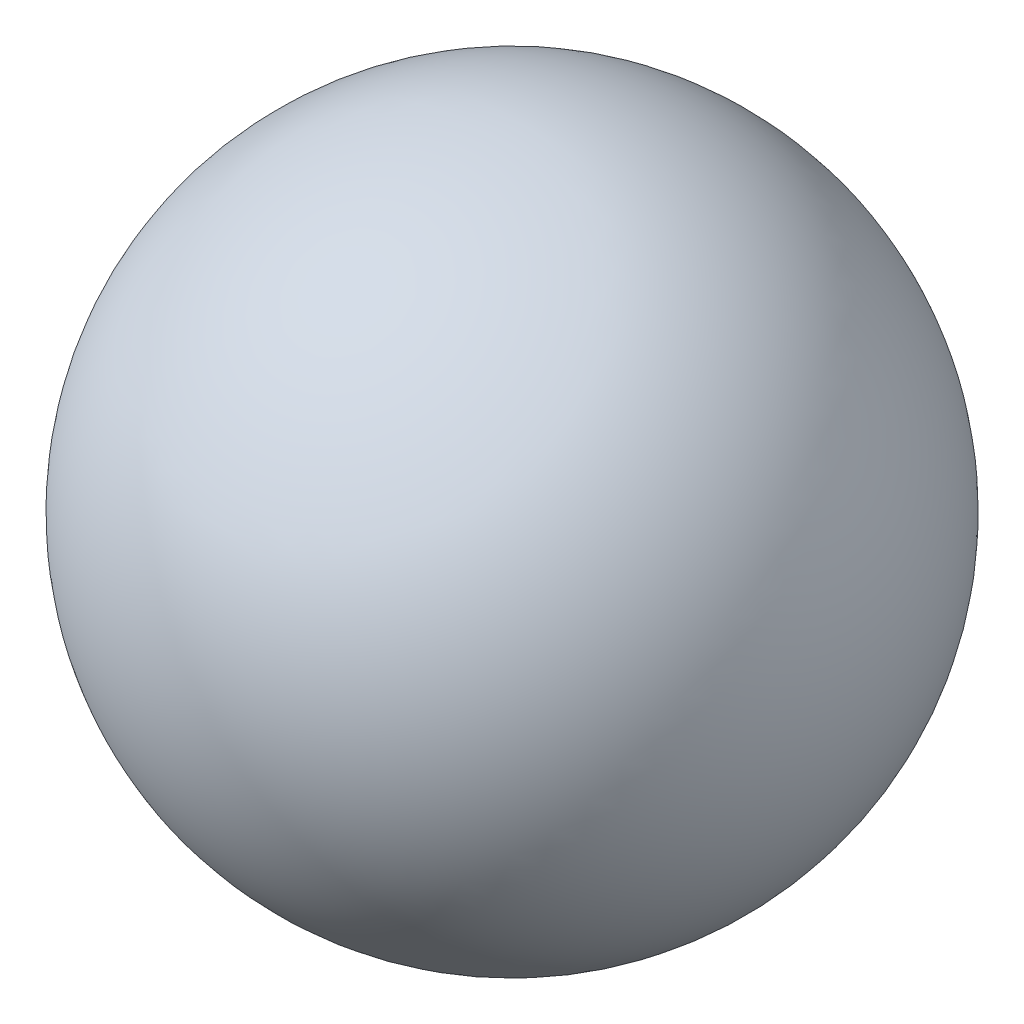
from build123d import *


with BuildPart() as part:
    # 草图1 → 旋转33 (revolve)
    with BuildSketch(Plane(origin=(0, 0, 0), x_dir=(1, 0, 0), z_dir=(0, 1, 0))):
        with BuildLine():
            ThreePointArc((0, 10), (-10, 0), (0, -10))
            Line((0, -10), (0, 10))
        make_face()
    revolve(axis=Axis((0, 0, 10), (0, 0, -1)))


solid = part.part
